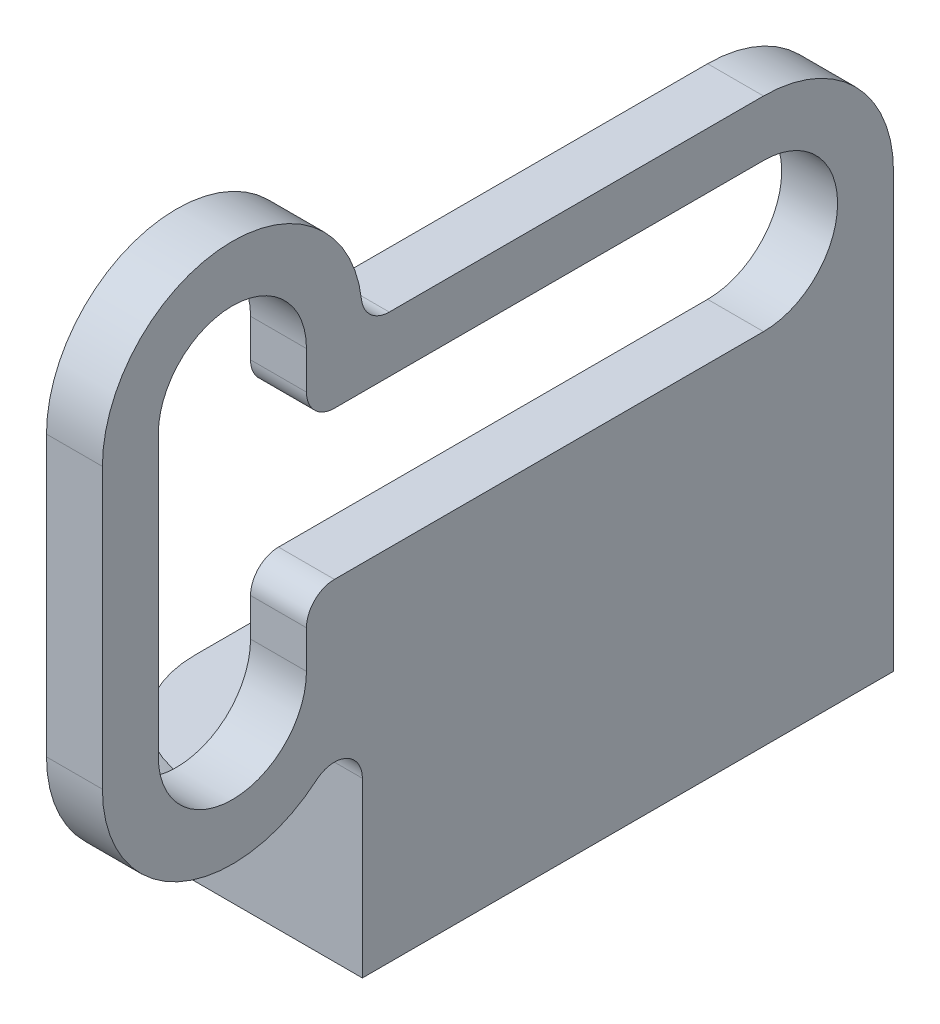
from build123d import *

# Parameters (mm, degrees)
BOSS_EXTRUDE1_DEPTH = 2
BOSS_EXTRUDE2_START = -16
BOSS_EXTRUDE2_DEPTH = 2
SKETCH3_W           = 19
SKETCH3_H           = 3
BOSS_EXTRUDE3_DEPTH = 8
FILLET1_R           = 4
SKETCH5_W           = 1
SKETCH5_H           = 3
HOLE1_AT_2_COUNT    = 2
HOLE1_AT_2_PITCH    = 11
CUT_EXTRUDE1_START  = 2
SKETCH6_R           = 1
CUT_EXTRUDE1_DEPTH  = 2
FILLET2_R           = 1


# Read off the part's stored shape, not the designer's step: Boss-Extrude2
with BuildPart() as part:
    # Sketch1 → Boss-Extrude1 (new body)
    with BuildSketch(Plane.ZY.offset(14)):
        with BuildLine():
            Line((12.85, 10.15), (-1.5, 10.15))
            ThreePointArc((-1.5, 10.15), (-6.15, 5.5), (-1.5, 0.85))
            Line((-1.5, 0.85), (12.85, 0.85))
            Line((12.85, 0.85), (12.85, 0.5))
            ThreePointArc((12.85, 0.5), (17.5, -4.15), (22.15, 0.5))
            Line((22.15, 0.5), (22.15, 10.5))
            ThreePointArc((22.15, 10.5), (17.5, 15.15), (12.85, 10.5))
            Line((12.85, 10.5), (12.85, 10.15))
        make_face()
        with BuildLine():
            Line((13.85, 8.15), (-1.5, 8.15))
            ThreePointArc((-1.5, 8.15), (-4.15, 5.5), (-1.5, 2.85))
            Line((-1.5, 2.85), (13.85, 2.85))
            ThreePointArc((13.85, 2.85), (14.557106781, 2.557106781), (14.85, 1.85))
            Line((14.85, 1.85), (14.85, 0.5))
            ThreePointArc((14.85, 0.5), (17.5, -2.15), (20.15, 0.5))
            Line((20.15, 0.5), (20.15, 10.5))
            ThreePointArc((20.15, 10.5), (17.5, 13.15), (14.85, 10.5))
            Line((14.85, 10.5), (14.85, 9.15))
            ThreePointArc((14.85, 9.15), (14.557106781, 8.442893219), (13.85, 8.15))
        make_face(mode=Mode.SUBTRACT)
    extrude(amount=BOSS_EXTRUDE1_DEPTH)

    # Boss-Extrude2 outline → Boss-Extrude2 (add)
    with BuildSketch(Plane.YZ.offset(BOSS_EXTRUDE2_START)):
        with BuildLine():
            Line((-10, 12.85), (-10, -6.15))
            Line((-10, -6.15), (5.5, -6.15))
            ThreePointArc((5.5, -6.15), (2.211953467, -4.788046533), (0.85, -1.5))
            Line((0.85, -1.5), (0.85, 12.85))
            Line((0.85, 12.85), (-10, 12.85))
        make_face()
    extrude(amount=BOSS_EXTRUDE2_DEPTH)

    # Sketch3 → Boss-Extrude3 (add)
    with BuildSketch(Plane.ZY.offset(16)):
        with Locations((3.35, -8.5)):
            Rectangle(SKETCH3_W, SKETCH3_H)
    extrude(amount=BOSS_EXTRUDE3_DEPTH)

    # Fillet1
    fillet1_edges = [part.edges().sort_by_distance(p)[0] for p in [
        (-24, -8.5, 12.85),
        (-24, -8.5, -6.15),
        (-16, -7, 3.35),
    ]]
    fillet(fillet1_edges, radius=FILLET1_R - 0.0001)  # a hair under: the kernel refuses the full size

    # Sketch5 → Hole1 (revolve, cut)
    with BuildSketch(Plane(origin=(-20, -7, -2.15), x_dir=(0, 0, 1), z_dir=(1, 0, 0))):
        with Locations((0.5, 1.5)):
            Rectangle(SKETCH5_W, SKETCH5_H)
    hole1 = revolve(axis=Axis((-20, -117, -2.15), (0, 1, 0)), mode=Mode.SUBTRACT)

    # Hole1 at 2: Hole1 ×2
    with Locations(*[(0, 0, i * HOLE1_AT_2_PITCH) for i in range(1, HOLE1_AT_2_COUNT)]):
        add(hole1, mode=Mode.SUBTRACT)

    # Sketch6 → Cut-Extrude1 (cut)
    with BuildSketch(Plane(origin=(0, -7, 0), x_dir=(1, 0, 0), z_dir=(0, 1, 0)).offset(CUT_EXTRUDE1_START)):
        with Locations(Location((-20, -8.85, 0), (0, 0, 270))):
            Circle(SKETCH6_R)
        with Locations(Location((-20, 2.15, 0), (0, 0, 270))):
            Circle(SKETCH6_R)
    extrude(amount=-CUT_EXTRUDE1_DEPTH, mode=Mode.SUBTRACT)

    # Fillet2
    fillet2_edges = [part.edges().sort_by_distance(p)[0] for p in [
        (-15, 10.15, 12.85),
    ]]
    fillet(fillet2_edges, radius=FILLET2_R)
    fillet2_2_edges = [part.edges().sort_by_distance(p)[0] for p in [
        (-15, 0.5, 12.85),
    ]]
    fillet(fillet2_2_edges, radius=FILLET2_R)


solid = part.part
